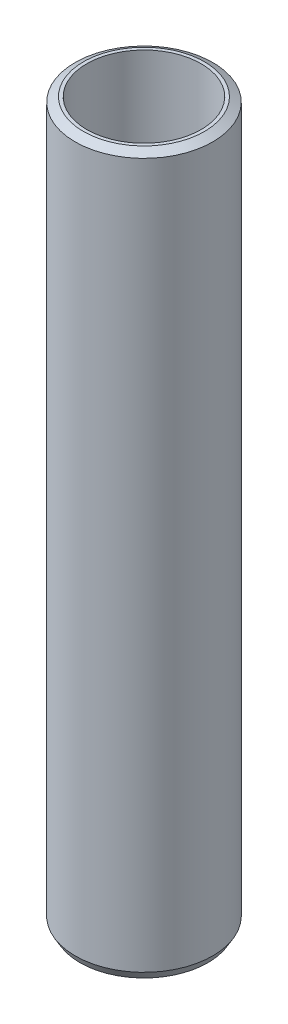
from build123d import *
from OCP.BRepFilletAPI import BRepFilletAPI_MakeChamfer

# Parameters (mm, degrees)
SKETCH1_R           = 57.5
BOSS_EXTRUDE1_DEPTH = 600
SKETCH2_R           = 47.748993913
CUT_EXTRUDE1_DEPTH  = 606.485342515
CHAMFER1_SIZE       = 4.023849184
CHAMFER1_SIZE2      = 6.969511228


with BuildPart() as part:
    # Sketch1 → Boss-Extrude1 (new body)
    with BuildSketch(Plane(origin=(0, 0, 0), x_dir=(1, 0, 0), z_dir=(0, 1, 0))):
        Circle(SKETCH1_R)
    extrude(amount=BOSS_EXTRUDE1_DEPTH)

    # Sketch2 → Cut-Extrude1 (cut, through all)
    with BuildSketch(Plane(origin=(0, 0, 0), x_dir=(1, 0, 0), z_dir=(0, 1, 0))):
        Circle(SKETCH2_R)
    extrude(amount=CUT_EXTRUDE1_DEPTH, mode=Mode.SUBTRACT)

    # Chamfer1: one chamfer whose edges measure the first distance from different faces: ONE call of the kernel's chamfer builder (chamfer() names one face for all edges)
    chamfer1_edges_1 = [part.edges().sort_by_distance(p)[0] for p in [
        (-57.5, 600, 0),
    ]]
    chamfer1_side_1 = [part.faces().sort_by_distance(p)[0] for p in [
        (-57.5, 300, 0),
    ]]
    chamfer1_edges_2 = [part.edges().sort_by_distance(p)[0] for p in [
        (-57.5, 0, 0),
    ]]
    chamfer1_side_2 = [part.faces().sort_by_distance(p)[0] for p in [
        (-55.873654403, 0, 0),
    ]]
    chamfer1 = BRepFilletAPI_MakeChamfer(part.part.solid().wrapped)
    for e in chamfer1_edges_1:
        chamfer1.Add(CHAMFER1_SIZE, CHAMFER1_SIZE2, e.wrapped, chamfer1_side_1[0].wrapped)  # the first distance lies on this face
    for e in chamfer1_edges_2:
        chamfer1.Add(CHAMFER1_SIZE, CHAMFER1_SIZE2, e.wrapped, chamfer1_side_2[0].wrapped)  # the first distance lies on this face
    add(Compound.cast(chamfer1.Shape()), mode=Mode.REPLACE)


solid = part.part
